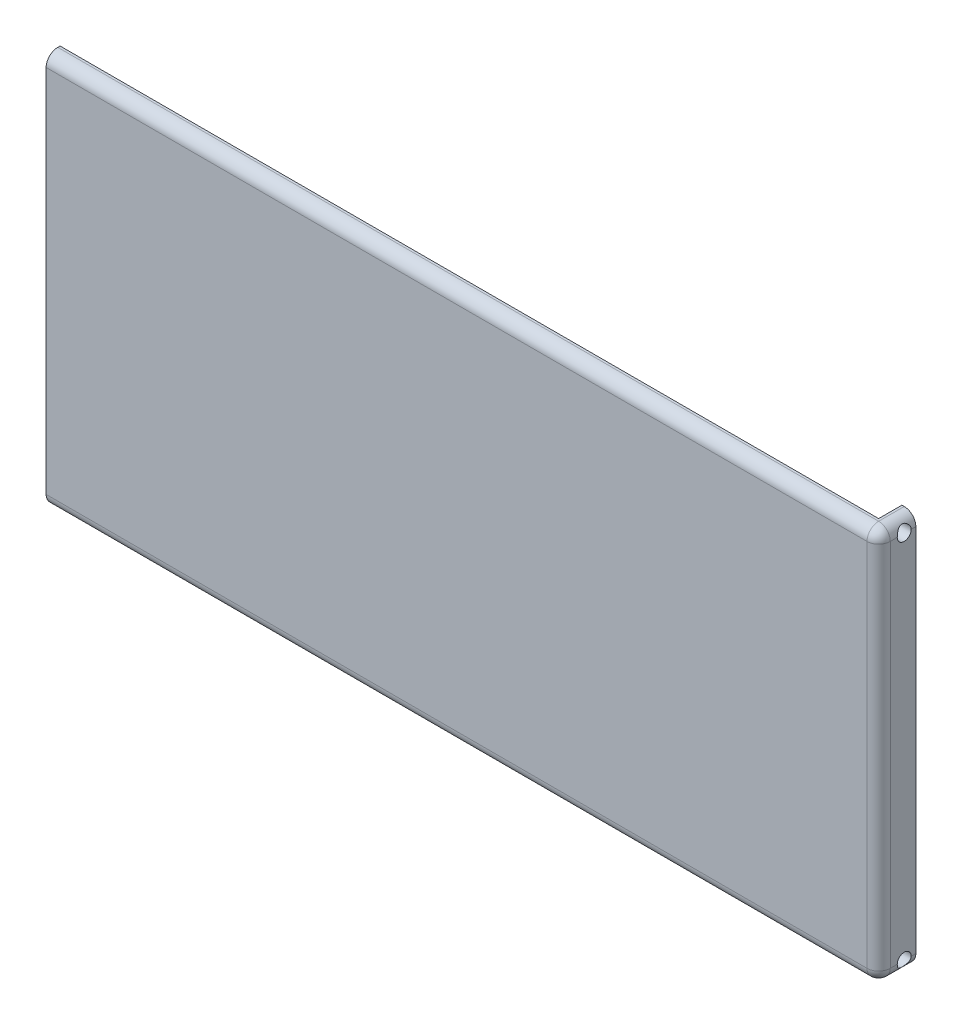
from build123d import *

# Parameters (mm, degrees)
SKETCH1_W           = 176
SKETCH1_H           = 84.5
BOSS_EXTRUDE1_DEPTH = 3
SKETCH2_W           = 8
SKETCH2_H           = 5
BOSS_EXTRUDE2_DEPTH = 3
SKETCH3_R           = 1.5
CUT_EXTRUDE1_DEPTH  = 3
SKETCH4_W           = 3
SKETCH4_H           = 8
BOSS_EXTRUDE3_DEPTH = 74.5
CUT_EXTRUDE2_DEPTH  = 3.1
FILLET3_R           = 2.5
FILLET4_R           = 2.5
FILLET7_R           = 2.5
LPATTERN1_COUNT     = 3
LPATTERN1_PITCH     = 25


with BuildPart() as part:
    # Sketch1 → Boss-Extrude1 (new body)
    with BuildSketch(Plane.XY):
        with Locations((88, -42.25)):
            Rectangle(SKETCH1_W, SKETCH1_H)
    extrude(amount=BOSS_EXTRUDE1_DEPTH)

    # Sketch2 → Boss-Extrude2 (add)
    with BuildSketch(Plane(origin=(176, 0, 0), x_dir=(0, 0, -1), z_dir=(1, 0, 0))):
        with Locations((1, -2.5)):
            Rectangle(SKETCH2_W, SKETCH2_H)
    boss_extrude2 = extrude(amount=BOSS_EXTRUDE2_DEPTH)

    # Sketch3 → Cut-Extrude1 (cut)
    with BuildSketch(Plane.ZY.offset(-176)):
        with Locations((-2.5, -2.5)):
            Circle(SKETCH3_R)
    cut_extrude1 = extrude(amount=-CUT_EXTRUDE1_DEPTH, mode=Mode.SUBTRACT)

    # Mirror3: Boss-Extrude2, Cut-Extrude1 across plane
    add(boss_extrude2.mirror(Plane(origin=(0, -42.25, 0), x_dir=(0, 0, 1), z_dir=(0, -1, 0))))
    add(cut_extrude1.mirror(Plane(origin=(0, -42.25, 0), x_dir=(0, 0, 1), z_dir=(0, -1, 0))), mode=Mode.SUBTRACT)

    # Sketch4 → Boss-Extrude3 (add)
    with BuildSketch(Plane(origin=(0, -79.5, 0), x_dir=(1, 0, 0), z_dir=(0, 1, 0))):
        with Locations((177.5, 1)):
            Rectangle(SKETCH4_W, SKETCH4_H)
    extrude(amount=BOSS_EXTRUDE3_DEPTH)

    # Sketch12 → Cut-Extrude2 (cut)
    with BuildSketch(Plane(origin=(0, -70, 0), x_dir=(-1, 0, 0), z_dir=(0, -1, 0))):
        with BuildLine():
            Line((-176, -2.5), (-176, 0))
            Line((-176, 0), (-176, 5))
            Line((-176, 5), (-178.5, 5))
            Line((-178.5, 5), (-178.5, 0))
            ThreePointArc((-178.5, 0), (-177.767766953, -1.767766953), (-176, -2.5))
        make_face()
    cut_extrude2 = extrude(amount=-CUT_EXTRUDE2_DEPTH, mode=Mode.SUBTRACT)

    # Fillet3
    fillet3_edges = [part.edges().sort_by_distance(p)[0] for p in [
        (179, -42.25, 3),
    ]]
    fillet(fillet3_edges, radius=FILLET3_R)

    # Fillet4
    # the kernel refuses this fillet: 2.5 mm, written as the material it takes off along each edge
    with BuildSketch(Plane(origin=(179, -84.5, 0.5), x_dir=(0, 1, 0), z_dir=(0, 0, -1))) as fillet4_piece_1:
        with BuildLine():
            CenterArc((FILLET4_R, -FILLET4_R), FILLET4_R, 90, 90)
            Line((0, -FILLET4_R), (0, 0))
            Line((0, 0), (FILLET4_R, 0))
        make_face()
    extrude(amount=11.75, mode=Mode.SUBTRACT)
    with BuildSketch(Plane(origin=(176.5, -84.5, 0.5), x_dir=(0, 0, 1), z_dir=(-1, 0, 0))) as fillet4_piece_2:
        with BuildLine():
            CenterArc((2.5 - FILLET4_R, FILLET4_R), FILLET4_R, 270, 90)
            Line((2.5 - FILLET4_R, 0), (2.5, 0))
            Line((2.5, 0), (2.5, FILLET4_R))
        make_face()
    revolve(axis=Axis((176.5, -84.5, 0.5), (0, 1, 0)), revolution_arc=90, mode=Mode.SUBTRACT)
    with BuildSketch(Plane(origin=(-6.25, -84.5, 3), x_dir=(0, 1, 0), z_dir=(1, 0, 0))) as fillet4_piece_3:
        with BuildLine():
            CenterArc((FILLET4_R, -FILLET4_R), FILLET4_R, 90, 90)
            Line((0, -FILLET4_R), (0, 0))
            Line((0, 0), (FILLET4_R, 0))
        make_face()
    extrude(amount=182.75, mode=Mode.SUBTRACT)

    # Fillet7
    # the kernel refuses this fillet: 2.5 mm, written as the material it takes off along each edge
    with BuildSketch(Plane(origin=(179, 0, 0.5), x_dir=(-1, 0, 0), z_dir=(0, 0, -1))) as fillet7_piece_1:
        with BuildLine():
            CenterArc((FILLET7_R, -FILLET7_R), FILLET7_R, 90, 90)
            Line((0, -FILLET7_R), (0, 0))
            Line((0, 0), (FILLET7_R, 0))
        make_face()
    extrude(amount=11.75, mode=Mode.SUBTRACT)
    with BuildSketch(Plane(origin=(-6.25, 0, 3), x_dir=(0, 0, -1), z_dir=(1, 0, 0))) as fillet7_piece_2:
        with BuildLine():
            CenterArc((FILLET7_R, -FILLET7_R), FILLET7_R, 90, 90)
            Line((0, -FILLET7_R), (0, 0))
            Line((0, 0), (FILLET7_R, 0))
        make_face()
    extrude(amount=182.75, mode=Mode.SUBTRACT)
    with BuildSketch(Plane(origin=(176.5, 0, 0.5), x_dir=(0, 0, 1), z_dir=(-1, 0, 0))) as fillet7_piece_3:
        with BuildLine():
            CenterArc((2.5 - FILLET7_R, -FILLET7_R), FILLET7_R, 0, 90)
            Line((2.5, -FILLET7_R), (2.5, 0))
            Line((2.5, 0), (2.5 - FILLET7_R, 0))
        make_face()
    revolve(axis=Axis((176.5, 0, 0.5), (0, 1, 0)), revolution_arc=90, mode=Mode.SUBTRACT)

    # LPattern1: Cut-Extrude2 ×3
    with Locations(*[(0, i * LPATTERN1_PITCH, 0) for i in range(1, LPATTERN1_COUNT)]):
        add(cut_extrude2, mode=Mode.SUBTRACT)


solid = part.part
